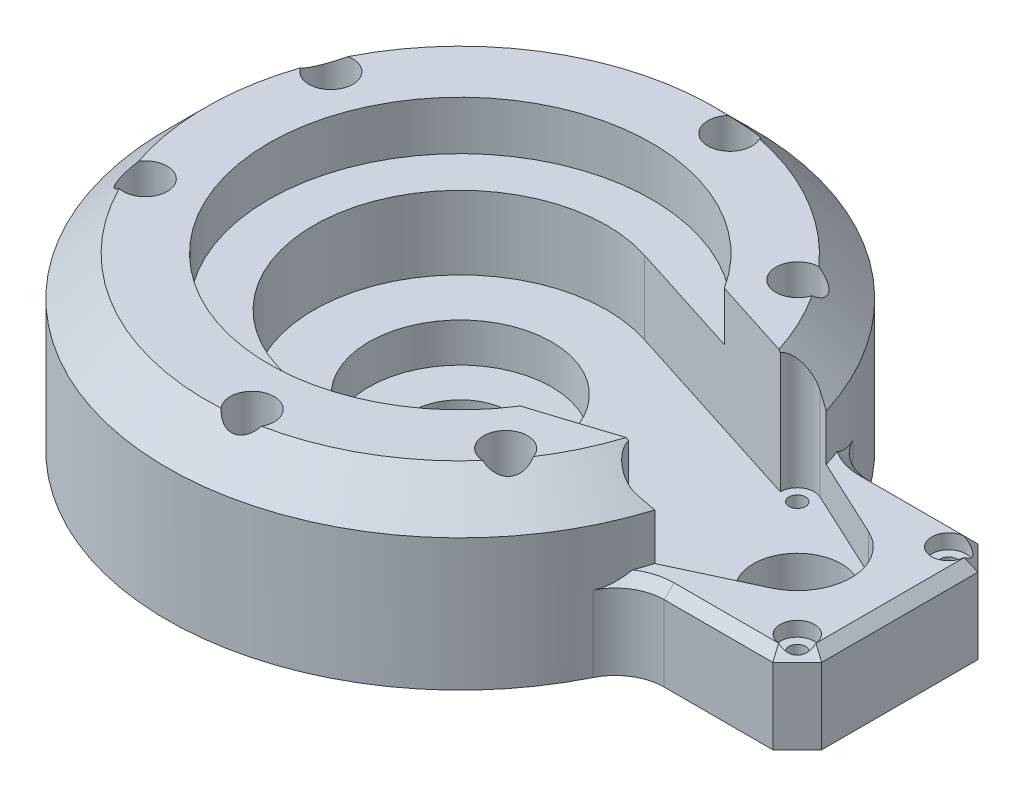
from build123d import *

# Parameters (mm, degrees)
SKETCH_1_R                      = 60
EXTRUDE_1_DEPTH                 = 35
SKETCH_2_W                      = 60
SKETCH_2_H                      = 42
EXTRUDE_2_DEPTH                 = 35
CHAMFER_1_SIZE                  = 5
SKETCH_5_R                      = 39.2
CUT_EXTRUDE_1_DEPTH             = 10
SKETCH_6_R                      = 18.7
CUT_EXTRUDE_2_DEPTH             = 15
SKETCH_7_R                      = 30
CUT_EXTRUDE_3_DEPTH             = 15
CUT_EXTRUDE_4_REACH             = 113.018
CUT_EXTRUDE_4_DIRECTION_2_DEPTH = 20
FILLET_1_R                      = 10
CHAMFER_2_SIZE                  = 2.196152423
CHAMFER_3_SIZE                  = 8
CHAMFER_4_SIZE                  = 2
SKETCH_9_R                      = 20
SKETCH_9_R_2                    = 10
EXTRUDE_4_DEPTH                 = 2
SKETCH_11_R                     = 2.2
CUT_EXTRUDE_5_DEPTH             = 114.688170062
SKETCH_12_R                     = 4.5
CUT_EXTRUDE_6_DEPTH             = 15
SKETCH_13_R                     = 1.7
CUT_EXTRUDE_7_DEPTH             = 114.688170093
CUT_EXTRUDE_11_REACH            = 115.688
SKETCH_16_R                     = 3.5
SKETCH_16_R_2                   = 11
SKETCH_17_R                     = 3.5
CUT_EXTRUDE_12_DEPTH            = 3
SKETCH_19_R                     = 9
CUT_EXTRUDE_13_DEPTH            = 112.018016632
SKETCH_21_R                     = 11.1
CUT_EXTRUDE_14_DEPTH            = 2.2


with BuildPart() as part:
    # 草图1 → 凸台-拉伸1 (new body)
    with BuildSketch(Plane(origin=(0, 0, 0), x_dir=(1, 0, 0), z_dir=(0, 1, 0))):
        with Locations(Location((0, 0, 0), (0, 0, 270))):
            Circle(SKETCH_1_R)
    extrude(amount=EXTRUDE_1_DEPTH)

    # 草图2 → 凸台-拉伸2 (add)
    with BuildSketch(Plane(origin=(0, 35, 0), x_dir=(1, 0, 0), z_dir=(0, 1, 0))):
        with Locations((60, 0)):
            Rectangle(SKETCH_2_W, SKETCH_2_H)
    extrude(amount=-EXTRUDE_2_DEPTH)

    # 倒角1
    chamfer_1_edges = [part.edges().sort_by_distance(p)[0] for p in [
        (90, 17.5, 21),
        (90, 17.5, -21),
    ]]
    chamfer(chamfer_1_edges, length=CHAMFER_1_SIZE)

    # 草图4 → 切除-旋转2 (revolve, cut)
    with BuildSketch(Plane.XY, mode=Mode.PRIVATE) as cut_revolve_2_sk:
        Polygon((90, 17.5), (60, 17.5), (60, 35), (115.576155226, 66.533788533), (104.161454132, 17.5), align=None)
    revolve(cut_revolve_2_sk.sketch.rotate(Axis((0, 0, 0), (0, 1, 0)), 20.487315115), axis=Axis((0, 0, 0), (0, 1, 0)), mode=Mode.SUBTRACT)

    # 草图5 → 切除-拉伸1 (cut)
    with BuildSketch(Plane(origin=(0, 35, 0), x_dir=(1, 0, 0), z_dir=(0, 1, 0))):
        with Locations(Location((0, 0, 0), (0, 0, 270))):
            Circle(SKETCH_5_R)
    extrude(amount=-CUT_EXTRUDE_1_DEPTH, mode=Mode.SUBTRACT)

    # 草图6 → 切除-拉伸2 (cut)
    with BuildSketch(Plane.XZ):
        with Locations(Location((0, 0, 0), (0, 0, 270))):
            Circle(SKETCH_6_R)
    extrude(amount=-CUT_EXTRUDE_2_DEPTH, mode=Mode.SUBTRACT)

    # 草图7 → 切除-拉伸3 (cut)
    with BuildSketch(Plane(origin=(0, 25, 0), x_dir=(1, 0, 0), z_dir=(0, 1, 0))):
        with Locations(Location((0, 0, 0), (0, 0, 270))):
            Circle(SKETCH_7_R)
    extrude(amount=-CUT_EXTRUDE_3_DEPTH, mode=Mode.SUBTRACT)

    # 切除-拉伸4: up to this face of the body (flat: up to its plane)
    cut_extrude_4_end = Plane(part.part.faces().sort_by_distance((0, 10, -29.151471863))[0])
    # 草图8 → 切除-拉伸4 (cut, up to the picked face)
    with BuildSketch(Plane(origin=(0, 25, 0), x_dir=(1, 0, 0), z_dir=(0, 1, 0)), mode=Mode.PRIVATE) as cut_extrude_4_sk1:
        with BuildLine():
            Line((71.739130435, 8.573048726), (9.130434783, 28.576829087))
            ThreePointArc((9.130434783, 28.576829087), (-30, 0), (9.130434783, -28.576829087))
            Line((9.130434783, -28.576829087), (71.739130435, -8.573048726))
            ThreePointArc((71.739130435, -8.573048726), (78, 0), (71.739130435, 8.573048726))
        make_face()
    cut_extrude_4_tool1 = split(extrude(cut_extrude_4_sk1.sketch, amount=-CUT_EXTRUDE_4_REACH, mode=Mode.PRIVATE), bisect_by=cut_extrude_4_end, keep=Keep.BOTH, mode=Mode.PRIVATE)
    add(cut_extrude_4_tool1.solids().sort_by(Axis((16.355777, 25, 0), (0, -1, 0)))[0], mode=Mode.SUBTRACT)

    # 草图8 → 切除-拉伸4 direction 2 (cut)
    with BuildSketch(Plane(origin=(0, 25, 0), x_dir=(1, 0, 0), z_dir=(0, 1, 0))):
        with BuildLine():
            Line((71.739130435, 8.573048726), (9.130434783, 28.576829087))
            ThreePointArc((9.130434783, 28.576829087), (-30, 0), (9.130434783, -28.576829087))
            Line((9.130434783, -28.576829087), (71.739130435, -8.573048726))
            ThreePointArc((71.739130435, -8.573048726), (78, 0), (71.739130435, 8.573048726))
        make_face()
    extrude(amount=CUT_EXTRUDE_4_DIRECTION_2_DEPTH, mode=Mode.SUBTRACT)

    # 圆角1
    # the kernel refuses this fillet: 10 mm, written as the material it adds along each edge
    with BuildSketch(Plane(origin=(56.204981986, 17.5, 21), x_dir=(1, 0, 0), z_dir=(0, -1, 0))) as fillet_1_piece_1:
        with BuildLine():
            CenterArc((6.556471152, 10), FILLET_1_R, 206.286320683, 63.713679317)
            ThreePointArc((-2.409450724, 5.571428571), (-1.134223568, 2.816203881), (0, 0))
            Line((0, 0), (6.556471152, 0))
        make_face()
    extrude(amount=17.5)
    with BuildSketch(Plane(origin=(56.204981986, 17.5, -21), x_dir=(1, 0, 0), z_dir=(0, -1, 0))) as fillet_1_piece_2:
        with BuildLine():
            CenterArc((6.556471152, -10), FILLET_1_R, 90, 63.713679317)
            ThreePointArc((-2.409450724, -5.571428571), (-1.134223568, -2.816203881), (0, 0))
            Line((0, 0), (6.556471152, 0))
        make_face()
    extrude(amount=17.5)

    # 倒角2
    # the kernel refuses this chamfer: 3, 2.196152423 mm, written as the material it takes off along each edge
    with BuildSketch(Plane(origin=(58.626954681, 42.533431537, -12.762452149), x_dir=(-0.2364968770053105, 0, -0.9716322489330699), z_dir=(0, -1, 0)), Plane(origin=(58.626954681, 17.5, 12.762452149), x_dir=(-0.23649687700531016, 1.9673259082088774e-15, 0.97163224893307), z_dir=(0, 1, 0))) as chamfer_2_piece_1:
        with BuildLine():
            Line((2.929363215, 0), (CHAMFER_2_SIZE * 0.520991857111, -CHAMFER_2_SIZE * 0.853561646606))
            Line((CHAMFER_2_SIZE * 0.520991857111, -CHAMFER_2_SIZE * 0.853561646606), (0, 0))
            ThreePointArc((0, 0), (1.506042049, 0.017865844), (2.929363215, 0))
        make_face()
    extrude(amount=25.033431537, mode=Mode.SUBTRACT)

    # 倒角3
    # the kernel refuses this chamfer: 8 mm, written as the material it takes off along each edge
    with BuildSketch(Plane(origin=(0, 35, 0), x_dir=(0.9966795405762429, 0, -0.08142415732895002), z_dir=(-0.08142415732895002, 0, -0.9966795405762429))) as chamfer_3_piece_1:
        Polygon((60 - CHAMFER_3_SIZE, 0), (60, CHAMFER_3_SIZE), (60, 0), align=None)
    revolve(axis=Axis((0, 35, 0), (0, -1, 0)), revolution_arc=344.183115921, mode=Mode.SUBTRACT)
    with BuildSketch(Plane(origin=(0, 35, 0), x_dir=(0.936749699758066, 0, -0.3500000000045331), z_dir=(-0.3500000000045331, 0, -0.936749699758066))) as chamfer_3_piece_2:
        Polygon((60 - CHAMFER_3_SIZE, 0), (60, CHAMFER_3_SIZE), (60, 0), align=None)
    revolve(axis=Axis((0, 35, 0), (0, -1, 0)), revolution_arc=25.054872626, mode=Mode.SUBTRACT)

    # 倒角4
    # the kernel refuses this chamfer: 2 mm, written as the material it takes off along each edge
    with BuildSketch(Plane(origin=(62.761453138, 17.5, -31), x_dir=(0, 0, 1), z_dir=(1, 0, 0))) as chamfer_4_piece_1_section:
        Polygon((10, CHAMFER_4_SIZE), (10 + CHAMFER_4_SIZE, 0), (10, 0), align=None)
    chamfer_4_piece_1 = revolve(axis=Axis((62.761453138, 17.5, -31), (0, -1, 0)), revolution_arc=113.821601389, mode=Mode.PRIVATE)
    chamfer_4_piece_1 = chamfer_4_piece_1 - Plane(origin=(0, 17.5, 0), x_dir=(0, 0, 1), z_dir=(0, -1, 0)) * Cylinder(60, 48, mode=Mode.PRIVATE)
    add(chamfer_4_piece_1, mode=Mode.SUBTRACT)
    with BuildSketch(Plane(origin=(81.36309104, 17.5, -24.63690896), x_dir=(-0.7071067811865476, 0, 0.7071067811865476), z_dir=(0.7071067811865476, 0, 0.7071067811865476)), Plane(origin=(93.63690896, 17.5, 12.36309104), x_dir=(-0.7071067811865476, 0, -0.7071067811865476), z_dir=(-0.7071067811865476, 0, 0.7071067811865476))) as chamfer_4_piece_2:
        Polygon((CHAMFER_4_SIZE, 0), (0, CHAMFER_4_SIZE), (0, 0), align=None)
    extrude(amount=17.357799764, mode=Mode.SUBTRACT)
    with BuildSketch(Plane(origin=(90, 17.5, 21.143365976), x_dir=(-1, 0, 0), z_dir=(0, 0, -1))) as chamfer_4_piece_3:
        Polygon((CHAMFER_4_SIZE, 0), (0, -CHAMFER_4_SIZE), (0, 0), align=None)
    extrude(amount=42.286731952, mode=Mode.SUBTRACT)
    with BuildSketch(Plane(origin=(90.143365976, 17.5, -21), x_dir=(0, -1, 0), z_dir=(-1, 0, 0))) as chamfer_4_piece_4:
        Polygon((CHAMFER_4_SIZE, 0), (0, CHAMFER_4_SIZE), (0, 0), align=None)
    extrude(amount=27.381912838, mode=Mode.SUBTRACT)
    with BuildSketch(Plane(origin=(62.761453138, 17.5, 21), x_dir=(0, 0, -1), z_dir=(1, 0, 0))) as chamfer_4_piece_5:
        Polygon((CHAMFER_4_SIZE, 0), (0, -CHAMFER_4_SIZE), (0, 0), align=None)
    extrude(amount=27.381912838, mode=Mode.SUBTRACT)
    with BuildSketch(Plane(origin=(62.761453138, 17.5, 31), x_dir=(-0.9148074600543132, 0, 0.40389022150700316), z_dir=(0.40389022150700316, 0, 0.9148074600543132))) as chamfer_4_piece_6_section:
        Polygon((10 + CHAMFER_4_SIZE, 0), (10, CHAMFER_4_SIZE), (10, 0), align=None)
    chamfer_4_piece_6 = revolve(axis=Axis((62.761453138, 17.5, 31), (0, -1, 0)), revolution_arc=113.821601389, mode=Mode.PRIVATE)
    chamfer_4_piece_6 = chamfer_4_piece_6 - Plane(origin=(0, 17.5, 0), x_dir=(0, 0, 1), z_dir=(0, -1, 0)) * Cylinder(60, 48, mode=Mode.PRIVATE)
    add(chamfer_4_piece_6, mode=Mode.SUBTRACT)

    # 草图9 → 凸台-拉伸4 (add)
    with BuildSketch(Plane.XZ):
        Circle(SKETCH_9_R)
        with Locations(Location((0, 0, 0), (0, 0, 270))):
            Circle(SKETCH_9_R_2, mode=Mode.SUBTRACT)
    extrude(amount=-EXTRUDE_4_DEPTH)

    # 草图11 → 切除-拉伸5 (cut, through all)
    with BuildSketch(Plane.XZ):
        with Locations(Location((6.295517328, -48.904155872, 0), (0, 0, 270))):
            Circle(SKETCH_11_R)
        with Locations(Location((39.204482672, -29.904155872, 0), (0, 0, 270))):
            Circle(SKETCH_11_R)
        with Locations(Location((-45.5, -19, 0), (0, 0, 270))):
            Circle(SKETCH_11_R)
        with Locations(Location((-45.5, 19, 0), (0, 0, 270))):
            Circle(SKETCH_11_R)
        with Locations(Location((6.295517328, 48.904155872, 0), (0, 0, 270))):
            Circle(SKETCH_11_R)
        with Locations(Location((39.204482672, 29.904155872, 0), (0, 0, 270))):
            Circle(SKETCH_11_R)
    extrude(amount=-CUT_EXTRUDE_5_DEPTH, mode=Mode.SUBTRACT)

    # 草图12 → 切除-拉伸6 (cut)
    with BuildSketch(Plane(origin=(0, 35, 0), x_dir=(1, 0, 0), z_dir=(0, 1, 0))):
        with Locations(Location((-45.5, 19, 0), (0, 0, 270))):
            Circle(SKETCH_12_R)
        with Locations(Location((-45.5, -19, 0), (0, 0, 270))):
            Circle(SKETCH_12_R)
        with Locations(Location((6.295517328, -48.904155872, 0), (0, 0, 270))):
            Circle(SKETCH_12_R)
        with Locations(Location((39.204482672, -29.904155872, 0), (0, 0, 270))):
            Circle(SKETCH_12_R)
        with Locations(Location((39.204482672, 29.904155872, 0), (0, 0, 270))):
            Circle(SKETCH_12_R)
        with Locations(Location((6.295517328, 48.904155872, 0), (0, 0, 270))):
            Circle(SKETCH_12_R)
    extrude(amount=-CUT_EXTRUDE_6_DEPTH, mode=Mode.SUBTRACT)

    # 草图13 → 切除-拉伸7 (cut, through all)
    with BuildSketch(Plane.XZ):
        with Locations(Location((84.5, -15.5, 0), (0, 0, 270))):
            Circle(SKETCH_13_R)
        with Locations(Location((53.5, -15.5, 0), (0, 0, 270))):
            Circle(SKETCH_13_R)
        with Locations(Location((84.5, 15.5, 0), (0, 0, 270))):
            Circle(SKETCH_13_R)
        with Locations(Location((53.5, 15.5, 0), (0, 0, 270))):
            Circle(SKETCH_13_R)
    extrude(amount=-CUT_EXTRUDE_7_DEPTH, mode=Mode.SUBTRACT)

    # 切除-拉伸11: up to this face of the body (flat: up to its plane)
    cut_extrude_11_end = Plane(part.part.faces().sort_by_distance((21.845822078, 10, 0))[0])
    # 草图16 → 切除-拉伸11 (cut, up to the picked face)
    with BuildSketch(Plane(origin=(0, 35, 0), x_dir=(1, 0, 0), z_dir=(0, 1, 0)), mode=Mode.PRIVATE) as cut_extrude_11_sk1:
        with Locations((53.5, -15.5)):
            Circle(SKETCH_16_R)
    cut_extrude_11_tool1 = split(extrude(cut_extrude_11_sk1.sketch, amount=-CUT_EXTRUDE_11_REACH, mode=Mode.PRIVATE), bisect_by=cut_extrude_11_end, keep=Keep.BOTH, mode=Mode.PRIVATE)
    # 草图16 → 切除-拉伸11 (cut, up to the picked face)
    with BuildSketch(Plane(origin=(0, 35, 0), x_dir=(1, 0, 0), z_dir=(0, 1, 0)), mode=Mode.PRIVATE) as cut_extrude_11_sk2:
        with Locations((53.5, 15.5)):
            Circle(SKETCH_16_R)
    cut_extrude_11_tool2 = split(extrude(cut_extrude_11_sk2.sketch, amount=-CUT_EXTRUDE_11_REACH, mode=Mode.PRIVATE), bisect_by=cut_extrude_11_end, keep=Keep.BOTH, mode=Mode.PRIVATE)
    # 草图16 → 切除-拉伸11 (cut, up to the picked face)
    with BuildSketch(Plane(origin=(0, 35, 0), x_dir=(1, 0, 0), z_dir=(0, 1, 0)), mode=Mode.PRIVATE) as cut_extrude_11_sk3:
        with BuildLine():
            ThreePointArc((57, -15.5), (56.451741672, -17.380750144), (54.978730798, -18.672279185))
            Line((54.978730798, -18.672279185), (73.64743965, -9.970020296))
            ThreePointArc((73.64743965, -9.970020296), (58, 0), (73.64743965, 9.970020296))
            Line((73.64743965, 9.970020296), (54.978730798, 18.672279185))
            ThreePointArc((54.978730798, 18.672279185), (56.451741672, 17.380750144), (57, 15.5))
            ThreePointArc((57, 15.5), (53.5, 12), (50, 15.5))
            Line((50, 15.5), (50, -15.5))
            ThreePointArc((50, -15.5), (53.5, -12), (57, -15.5))
        make_face()
    cut_extrude_11_tool3 = split(extrude(cut_extrude_11_sk3.sketch, amount=-CUT_EXTRUDE_11_REACH, mode=Mode.PRIVATE), bisect_by=cut_extrude_11_end, keep=Keep.BOTH, mode=Mode.PRIVATE)
    # 草图16 → 切除-拉伸11 (cut, up to the picked face)
    with BuildSketch(Plane(origin=(0, 35, 0), x_dir=(1, 0, 0), z_dir=(0, 1, 0)), mode=Mode.PRIVATE) as cut_extrude_11_sk4:
        with Locations((69, 0)):
            Circle(SKETCH_16_R_2)
    cut_extrude_11_tool4 = split(extrude(cut_extrude_11_sk4.sketch, amount=-CUT_EXTRUDE_11_REACH, mode=Mode.PRIVATE), bisect_by=cut_extrude_11_end, keep=Keep.BOTH, mode=Mode.PRIVATE)
    add(cut_extrude_11_tool1.solids().sort_by(Axis((53.5, 35, 15.5), (0, -1, 0)))[0], mode=Mode.SUBTRACT)
    add(cut_extrude_11_tool2.solids().sort_by(Axis((53.5, 35, -15.5), (0, -1, 0)))[0], mode=Mode.SUBTRACT)
    add(cut_extrude_11_tool3.solids().sort_by(Axis((57.12752, 35, 0), (0, -1, 0)))[0], mode=Mode.SUBTRACT)
    add(cut_extrude_11_tool4.solids().sort_by(Axis((69, 35, 0), (0, -1, 0)))[0], mode=Mode.SUBTRACT)

    # 草图17 → 切除-拉伸12 (cut)
    with BuildSketch(Plane(origin=(0, 17.5, 0), x_dir=(1, 0, 0), z_dir=(0, 1, 0))):
        with Locations(Location((84.5, -15.5, 0), (0, 0, 270))):
            Circle(SKETCH_17_R)
        with Locations(Location((84.5, 15.5, 0), (0, 0, 270))):
            Circle(SKETCH_17_R)
    extrude(amount=-CUT_EXTRUDE_12_DEPTH, mode=Mode.SUBTRACT)

    # 草图19 → 切除-拉伸13 (cut, through all)
    with BuildSketch(Plane(origin=(0, 10, 0), x_dir=(1, 0, 0), z_dir=(0, 1, 0))):
        with Locations(Location((69, 0, 0), (0, 0, 270))):
            Circle(SKETCH_19_R)
    extrude(amount=-CUT_EXTRUDE_13_DEPTH, mode=Mode.SUBTRACT)

    # 草图21 → 切除-拉伸14 (cut)
    with BuildSketch(Plane.XZ):
        with Locations(Location((69, 0, 0), (0, 0, 270))):
            Circle(SKETCH_21_R)
    extrude(amount=-CUT_EXTRUDE_14_DEPTH, mode=Mode.SUBTRACT)


solid = part.part
